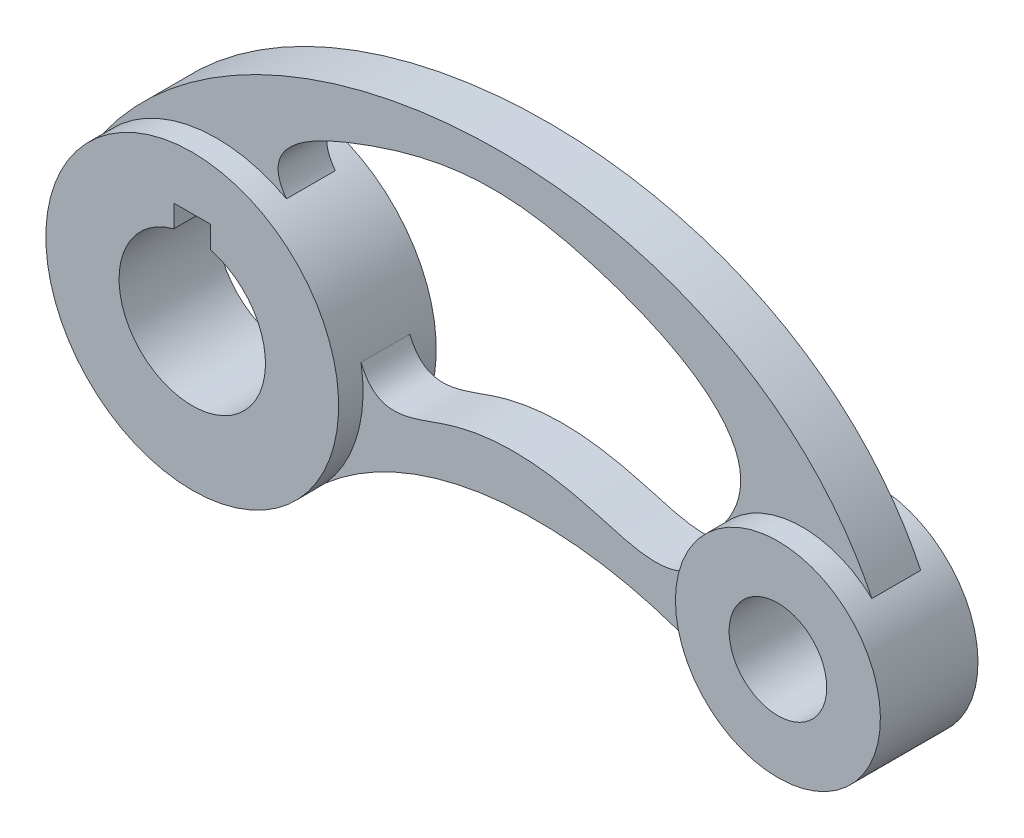
from build123d import *

# Parameters (mm, degrees)
BOSS_EXTRUDE3_DEPTH      = 10
BOSS_EXTRUDE3_DEPTH_BACK = 10
SKETCH1_R                = 30
BOSS_EXTRUDE4_DEPTH      = 10
BOSS_EXTRUDE4_DEPTH_BACK = 10
SKETCH1_6_R              = 10
BOSS_EXTRUDE5_START      = -5
BOSS_EXTRUDE5_DEPTH      = 10
BOSS_EXTRUDE6_DEPTH      = 5
BOSS_EXTRUDE6_DEPTH_BACK = 5


# Read off the part's stored shape, not the designer's step: Boss-Extrude5
with BuildPart() as part:
    # Sketch1 → Boss-Extrude3 (new, two sides: drawn at the far end of the back side and taken through both)
    with BuildSketch(Plane.XY.offset(-BOSS_EXTRUDE3_DEPTH_BACK)):
        with Locations((-91.686183624, 0.192134417)):
            Circle(SKETCH1_R)
        with BuildLine():
            Line((-87.89977254, 14.706371948), (-87.89977254, 19.276034186))
            Line((-87.89977254, 19.276034186), (-95.472594708, 19.276034186))
            Line((-95.472594708, 19.276034186), (-95.472594708, 14.706371948))
            ThreePointArc((-95.472594708, 14.706371948), (-91.686183624, -14.807865583), (-87.89977254, 14.706371948))
        make_face(mode=Mode.SUBTRACT)
    extrude(amount=BOSS_EXTRUDE3_DEPTH + BOSS_EXTRUDE3_DEPTH_BACK)



with BuildPart() as body_2:
    # Sketch1<6> → Boss-Extrude4 (new, two sides: drawn at the far end of the back side and taken through both)
    with BuildSketch(Plane.XY.offset(-BOSS_EXTRUDE4_DEPTH_BACK)):
        with BuildLine():
            ThreePointArc((11.112339015, 12.238261455), (8.949972375, 8.318729369), (7.667477785, 4.02993363))
            ThreePointArc((7.667477785, 4.02993363), (8.170454057, -5.744611701), (13.049003536, -14.229567596))
            ThreePointArc((13.049003536, -14.229567596), (36.073936554, -19.321464298), (49.313816376, 0.192134417))
            ThreePointArc((49.313816376, 0.192134417), (47.553215185, 8.609113298), (42.566622712, 15.614764269))
            ThreePointArc((42.566622712, 15.614764269), (26.961003361, 21.148515234), (12.196391219, 13.65425187))
            add(Edge.make_bspline(
                [(12.196391219, 13.65425187), (11.861354172, 13.187034207), (11.500278102, 12.715041734), (11.112339015, 12.238261455)],
                knots=[0.989038954, 0.989038954, 0.989038954, 0.989038954, 1, 1, 1, 1], degree=3))
        make_face()
        with Locations((28.313816376, 0.192134417)):
            Circle(SKETCH1_6_R, mode=Mode.SUBTRACT)
    extrude(amount=BOSS_EXTRUDE4_DEPTH + BOSS_EXTRUDE4_DEPTH_BACK)


with BuildPart() as part_1:
    add(part.part)

    add(body_2.part)  # Boss-Extrude5 merges body 2
    # Boss-Extrude5 outline → Boss-Extrude5 (add)
    with BuildSketch(Plane.XY.offset(BOSS_EXTRUDE5_START)):
        with BuildLine():
            add(Edge.make_bspline(
                [(-117.149088001, 16.055315078), (-84.551754221, 68.506180692), (15.074459949, 72.729657691), (42.566622712, 15.614764269)],
                knots=[0.000619794, 0.000619794, 0.000619794, 0.000619794, 1, 1, 1, 1], degree=3))
            ThreePointArc((-117.149088001, 16.055315078), (-99.352173325, 29.196144551), (-77.386565231, 26.564864967))
            add(Edge.make_bspline(
                [(-77.386565231, 26.564864967), (-83.432288651, 34.664995437), (-50.628420979, 50.565174626), (-18.016895415, 51.553449374), (24.068279094, 30.209900729), (12.196391219, 13.65425187)],
                knots=[0, 0, 0, 0, 0.204044151, 0.600639193, 0.989038954, 0.989038954, 0.989038954, 0.989038954], degree=3))
            ThreePointArc((12.196391219, 13.65425187), (26.961003361, 21.148515233), (42.566622712, 15.614764269))
        make_face()
    extrude(amount=BOSS_EXTRUDE5_DEPTH)

    # Sketch1<9> → Boss-Extrude6 (add, two sides: drawn at the far end of the back side and taken through both)
    with BuildSketch(Plane.XY.offset(-BOSS_EXTRUDE6_DEPTH_BACK)):
        with BuildLine():
            ThreePointArc((-62.104914378, 5.186982743), (-61.791049594, 2.69831903), (-61.686183624, 0.192134417))
            ThreePointArc((-61.686183624, 0.192134417), (-63.670678381, -10.537798759), (-69.361614689, -19.848165527))
            add(Edge.make_bspline(
                [(-69.361614689, -19.848165527), (-47.016372637, -0.448672031), (-12.207357242, -1.380964616), (13.049003536, -14.229567596)],
                knots=[0, 0, 0, 0, 1, 1, 1, 1], degree=3))
            ThreePointArc((13.049003536, -14.229567596), (8.170454057, -5.744611701), (7.667477785, 4.02993363))
            add(Edge.make_bspline(
                [(-62.104914378, 5.186982743), (-58.601516264, -3.263955738), (-40.915796903, 6.605274961), (-17.364164136, 4.856859209), (1.372861242, -2.886960631), (7.667477785, 4.02993363)],
                knots=[0, 0, 0, 0, 0.26578307, 0.675204605, 1, 1, 1, 1], degree=3))
        make_face()
    extrude(amount=BOSS_EXTRUDE6_DEPTH + BOSS_EXTRUDE6_DEPTH_BACK)


solid = part_1.part
